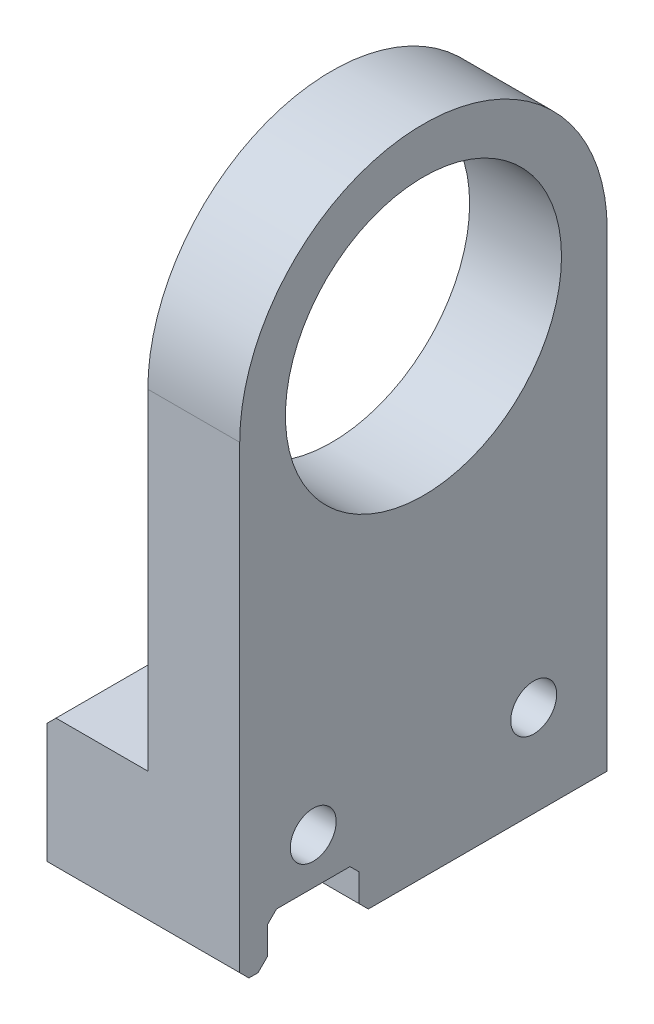
from build123d import *
from build123d.topology import SkipClean

# Parameters (mm, degrees)
SKETCH_1_W          = 21
SKETCH_1_H          = 40
EXTRUDE_1_DEPTH     = 5
SKETCH_2_W          = 10
SKETCH_2_H          = 40
EXTRUDE_2_DEPTH     = 36
SKETCH_3_R          = 20
EXTRUDE_3_DEPTH     = 10
SKETCH_4_R          = 15.025
CUT_EXTRUDE_1_DEPTH = 10
SKETCH_6_W          = 21
SKETCH_6_H          = 40
EXTRUDE_4_DEPTH     = 10
SKETCH_5_R          = 3.1
CUT_EXTRUDE_2_DEPTH = 15
CHAMFER_2_SIZE      = 1
THREAD_1_PITCH      = 1
THREAD_1_TO         = 14
SKETCH_11_W         = 10
SKETCH_11_H         = 5
CUT_EXTRUDE_4_DEPTH = 30
CHAMFER_3_SIZE      = 1
SKETCH_12_R         = 2.5
CUT_EXTRUDE_5_DEPTH = 10


with BuildPart() as part:
    # Sketch 1 → 凸台-拉伸1 (new body)
    with BuildSketch(Plane(origin=(0, 0, 0), x_dir=(1, 0, 0), z_dir=(0, 1, 0))):
        Rectangle(SKETCH_1_W, SKETCH_1_H)
    extrude(amount=EXTRUDE_1_DEPTH)

    # 草图2 → 凸台-拉伸2 (add)
    with BuildSketch(Plane(origin=(0, 5, 0), x_dir=(1, 0, 0), z_dir=(0, 1, 0))):
        with Locations((5.5, 0)):
            Rectangle(SKETCH_2_W, SKETCH_2_H)
    extrude(amount=EXTRUDE_2_DEPTH)

    # 草图3 → 凸台-拉伸3 (add)
    with BuildSketch(Plane(origin=(10.5, 0, 0), x_dir=(0, 0, -1), z_dir=(1, 0, 0))):
        with Locations((0, 41)):
            Circle(SKETCH_3_R)
    extrude(amount=-EXTRUDE_3_DEPTH)

    # 草图4 → 切除-拉伸1 (cut)
    with BuildSketch(Plane(origin=(10.5, 0, 0), x_dir=(0, 0, -1), z_dir=(1, 0, 0))):
        with Locations((0, 41)):
            Circle(SKETCH_4_R)
    extrude(amount=-CUT_EXTRUDE_1_DEPTH, mode=Mode.SUBTRACT)

    # 草图6 → 凸台-拉伸4 (add)
    with BuildSketch(Plane.XZ):
        Rectangle(SKETCH_6_W, SKETCH_6_H)
    extrude(amount=EXTRUDE_4_DEPTH)

    # 草图5 → 切除-拉伸2 (cut, symmetric)
    with BuildSketch(Plane.XZ):
        with Locations(Location((-5.5, 0, 0), (0, 0, 270))):
            Circle(SKETCH_5_R)
    extrude(amount=CUT_EXTRUDE_2_DEPTH, both=True, mode=Mode.SUBTRACT)

    # 倒角2
    chamfer_2_edges = [part.edges().sort_by_distance(p)[0] for p in [
        (-5.5, -10, 3.1),
    ]]
    chamfer(chamfer_2_edges, length=CHAMFER_2_SIZE)

    # 螺纹线1: arcs per turn and ends read off the stored shape
    # 螺纹线1: the profile of Sketch 1 2 profile screwed along a right-hand helix through 15 turns, 8 arcs to a turn; built about Z, then put on its axis
    with SkipClean():  # the faces are left unmerged after this step: merging them gives an invalid solid
        thread_1_z = Axis((0, 0, 0), (0, 0, 1))
        thread_1_corners = [(3.1003, 0, -0.000173205), (3.1003, 0, 0.875173202), (2.558734125, 0, 0.562499999), (2.558734125, 0, 0.312499999)]
        with BuildLine(mode=Mode.PRIVATE) as thread_1_profile:
            Line(thread_1_corners[0], thread_1_corners[1])
            Line(thread_1_corners[1], thread_1_corners[2])
            Line(thread_1_corners[2], thread_1_corners[3])
            Line(thread_1_corners[3], thread_1_corners[0])
        thread_1_cap = Face(thread_1_profile.wire())
        thread_1_turn_angles = [0, 22.5, 45, 67.5, 90, 112.5, 135, 157.5, 180, 202.5, 225, 247.5, 270, 292.5, 315, 337.5, 360]
        thread_1_turn_weights = [1, 0.9238795325112867, 1, 0.9238795325112867, 1, 0.9238795325112867, 1, 0.9238795325112867, 1, 0.9238795325112867, 1, 0.9238795325112867, 1, 0.9238795325112867, 1, 0.9238795325112867, 1]
        thread_1_turn_rails = [Edge.make_bspline([Vector(p[0], p[1], 0).rotate(thread_1_z, thread_1_turn_angles[k]) / thread_1_turn_weights[k] + Vector(0, 0, p[2] + THREAD_1_PITCH * thread_1_turn_angles[k] / 360) for k in range(17)], [0, 0, 0, 1, 1, 2, 2, 3, 3, 4, 4, 5, 5, 6, 6, 7, 7, 8, 8, 8], 2, thread_1_turn_weights) for p in thread_1_corners]
        thread_1_turn_sides = [Face.make_surface_from_curves(thread_1_turn_rails[p[0]], thread_1_turn_rails[p[1]]) for p in [(0, 1), (1, 2), (2, 3), (3, 0)]]
        thread_1 = Plane(origin=(-5.5, -9, 0), x_dir=(1, 0, 0), z_dir=(0, 1, 0)) * split(Solid(Shell([*[p.moved(Location((0, 0, THREAD_1_PITCH * i))) for i in range(15) for p in thread_1_turn_sides], thread_1_cap, thread_1_cap.rotate(thread_1_z, 5400).moved(Location((0, 0, THREAD_1_PITCH * 5400 / 360)))])), bisect_by=Plane.XY.offset(THREAD_1_TO), keep=Keep.BOTTOM, mode=Mode.PRIVATE)
        add(thread_1)

    # 草图11 → 切除-拉伸4 (cut)
    with BuildSketch(Plane(origin=(10.5, 0, 0), x_dir=(0, 0, -1), z_dir=(1, 0, 0))):
        with Locations((-12, -7.5)):
            Rectangle(SKETCH_11_W, SKETCH_11_H)
    extrude(amount=-CUT_EXTRUDE_4_DEPTH, mode=Mode.SUBTRACT)

    # 倒角3
    chamfer_3_edges = [part.edges().sort_by_distance(p)[0] for p in [
        (-10.5, 5, 0),
        (0, -10, 20),
        (0, -10, 7),
        (0, -10, 17),
        (0, -5, 17),
        (0, -5, 7),
    ]]
    chamfer(chamfer_3_edges, length=CHAMFER_3_SIZE)

    # 草图12 → 切除-拉伸5 (cut)
    with BuildSketch(Plane(origin=(10.5, 0, 0), x_dir=(0, 0, -1), z_dir=(1, 0, 0))):
        with Locations((12, 0)):
            Circle(SKETCH_12_R)
        with Locations((-12, 0)):
            Circle(SKETCH_12_R)
    extrude(amount=-CUT_EXTRUDE_5_DEPTH, mode=Mode.SUBTRACT)


solid = part.part
